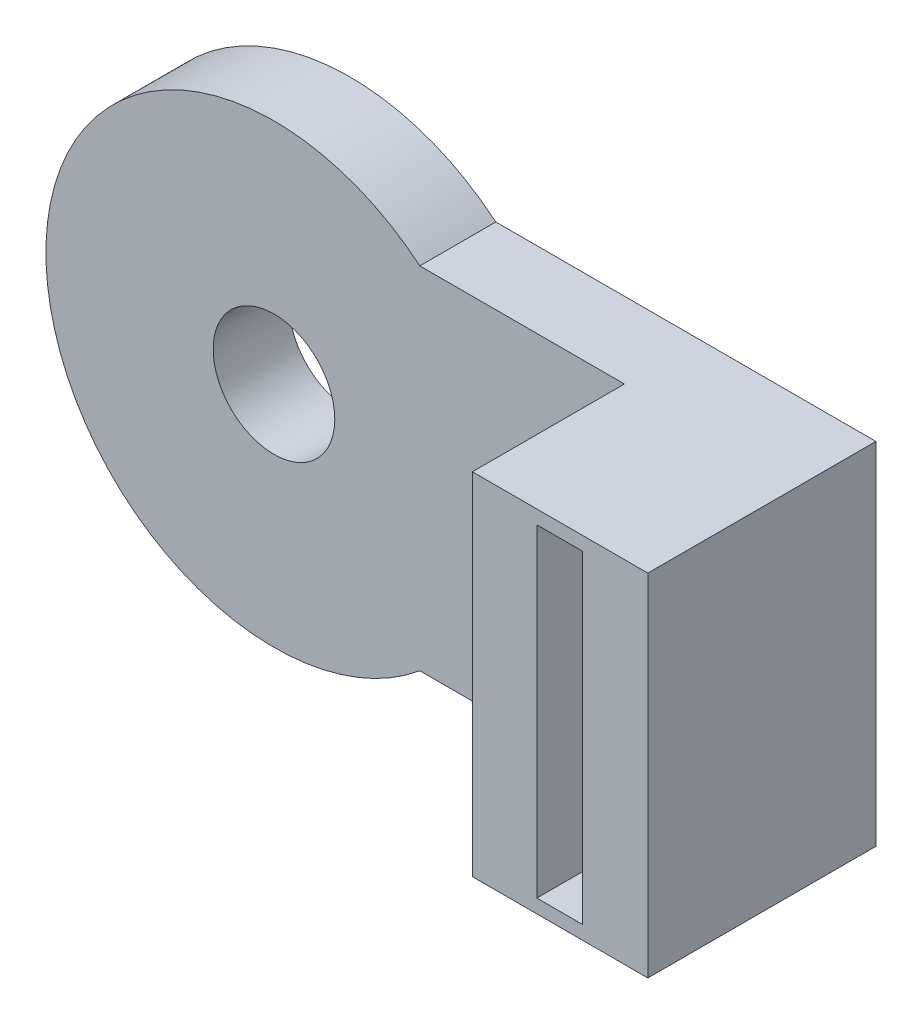
from build123d import *

# Parameters (mm, degrees)
SCHIZZO1_R                   = 4
ESTRUSIONE_ESTRUSIONE1_DEPTH = 2.5
SCHIZZO2_W                   = 11.541716885
SCHIZZO2_H                   = 23.064788922
ESTRUSIONE_ESTRUSIONE2_DEPTH = 10
SCHIZZO3_W                   = 3
SCHIZZO3_H                   = 21.26
TAGLIO_ESTRUSIONE1_DEPTH     = 13


with BuildPart() as part:
    # Schizzo1 → Estrusione-Estrusione1 (new, symmetric)
    with BuildSketch(Plane.XY):
        with BuildLine():
            Line((9.591865199, -11.532394461), (34.591865199, -11.532394461))
            Line((34.591865199, -11.532394461), (34.591865199, 11.532394461))
            Line((34.591865199, 11.532394461), (9.591865199, 11.532394461))
            ThreePointArc((9.591865199, 11.532394461), (-15, 0), (9.591865199, -11.532394461))
        make_face()
        Circle(SCHIZZO1_R, mode=Mode.SUBTRACT)
    extrude(amount=ESTRUSIONE_ESTRUSIONE1_DEPTH, both=True)

    # Schizzo2 → Estrusione-Estrusione2 (add)
    with BuildSketch(Plane.XY.offset(2.5)):
        with Locations((28.821006757, 0)):
            Rectangle(SCHIZZO2_W, SCHIZZO2_H)
    extrude(amount=ESTRUSIONE_ESTRUSIONE2_DEPTH)

    # Schizzo3 → Taglio-Estrusione1 (cut)
    with BuildSketch(Plane.XY.offset(12.5)):
        with Locations((28.789097076, 0)):
            Rectangle(SCHIZZO3_W, SCHIZZO3_H)
    extrude(amount=-TAGLIO_ESTRUSIONE1_DEPTH, mode=Mode.SUBTRACT)


solid = part.part
